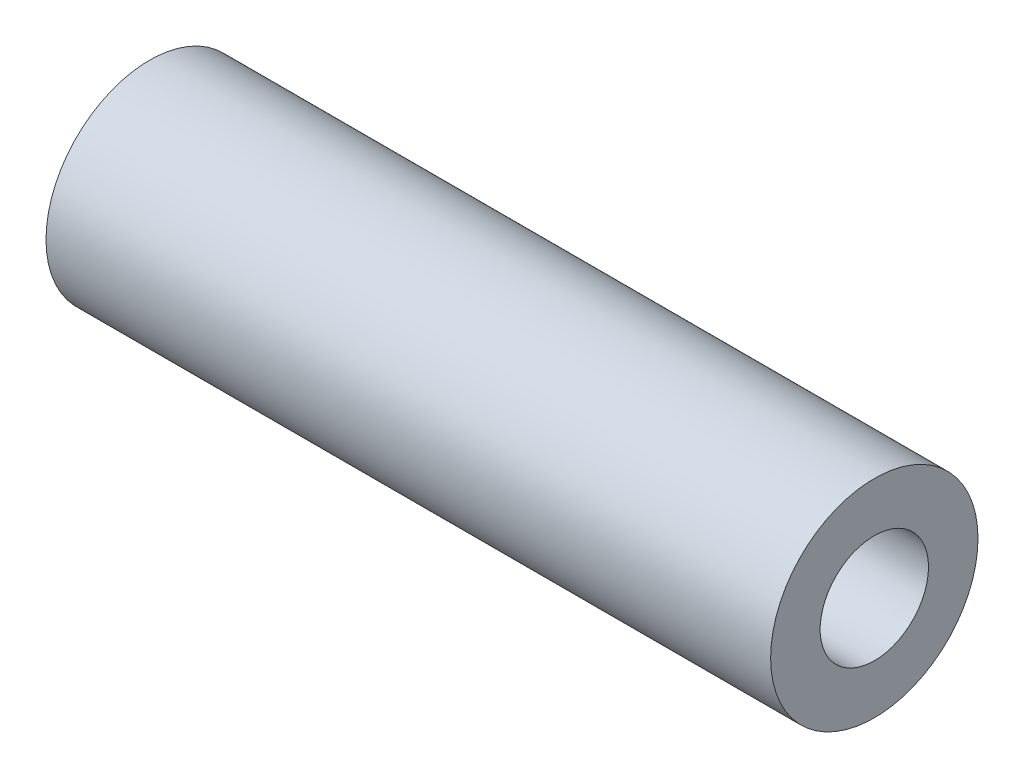
from build123d import *

# Parameters (mm, degrees)
SKETCH1_R           = 4.7625
SKETCH1_R_2         = 2.4892
BOSS_EXTRUDE1_DEPTH = 16.64335


with BuildPart() as part:
    # Sketch1 → Boss-Extrude1 (new, symmetric)
    with BuildSketch(Plane(origin=(0, 0, 0), x_dir=(0, 0, -1), z_dir=(1, 0, 0))):
        Circle(SKETCH1_R)
        Circle(SKETCH1_R_2, mode=Mode.SUBTRACT)
    extrude(amount=BOSS_EXTRUDE1_DEPTH, both=True)


solid = part.part
